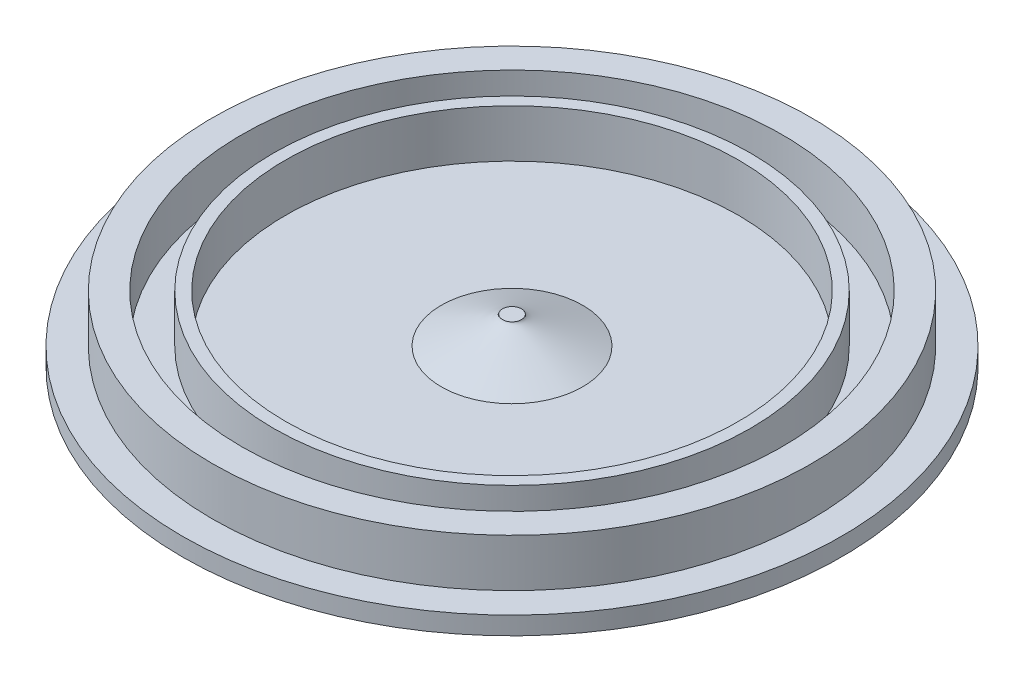
from build123d import *

# Parameters (mm, degrees)
SKETCH1_R           = 69.85
BOSS_EXTRUDE1_DEPTH = 3.81
SKETCH2_R           = 63.5
SKETCH2_R_2         = 57.2897
BOSS_EXTRUDE2_DEPTH = 10.16
SKETCH3_R           = 50.546
SKETCH3_R_2         = 48.006
BOSS_EXTRUDE3_DEPTH = 10.16


with BuildPart() as part:
    # Sketch1 → Boss-Extrude1 (new body)
    with BuildSketch(Plane(origin=(0, 0, 0), x_dir=(1, 0, 0), z_dir=(0, 1, 0))):
        with Locations(Location((0, 0, 0), (0, 0, 90))):
            Circle(SKETCH1_R)
    extrude(amount=BOSS_EXTRUDE1_DEPTH)

    # Sketch2 → Boss-Extrude2 (add)
    with BuildSketch(Plane(origin=(0, 3.81, 0), x_dir=(1, 0, 0), z_dir=(0, 1, 0))):
        with Locations(Location((0, 0, 0), (0, 0, 270))):
            Circle(SKETCH2_R)
        with Locations(Location((0, 0, 0), (0, 0, 270))):
            Circle(SKETCH2_R_2, mode=Mode.SUBTRACT)
    extrude(amount=BOSS_EXTRUDE2_DEPTH)

    # Sketch3 → Boss-Extrude3 (add)
    with BuildSketch(Plane(origin=(0, 3.81, 0), x_dir=(1, 0, 0), z_dir=(0, 1, 0))):
        with Locations(Location((0, 0, 0), (0, 0, 270))):
            Circle(SKETCH3_R)
        with Locations(Location((0, 0, 0), (0, 0, 270))):
            Circle(SKETCH3_R_2, mode=Mode.SUBTRACT)
    extrude(amount=BOSS_EXTRUDE3_DEPTH)

    # Loft1: read off the stored shape, not the designer's step
    # Loft1: loft between two sections, ruled curve by curve
    loft1_from = [
        Edge.make_bspline([(-1.815697125, 9.652, 0.82394245), (-3.463582025, 9.652, -2.8074518), (0.167812225, 9.652, -4.4553367), (1.815697125, 9.652, -0.82394245), (3.463582025, 9.652, 2.8074518), (-0.167812225, 9.652, 4.4553367), (-1.815697125, 9.652, 0.82394245)], [0, 0, 0, 0, 0.5, 0.5, 0.5, 1, 1, 1, 1], 3, [1, 0.333333333, 0.333333333, 1, 0.333333333, 0.333333333, 1]),
    ]
    loft1_to = [
        Edge.make_bspline([(4.253244453, 3.81, 14.369763659), (-24.486282866, 3.81, 22.876252565), (-32.992771771, 3.81, -5.863274754), (-4.253244453, 3.81, -14.369763659), (24.486282866, 3.81, -22.876252565), (32.992771771, 3.81, 5.863274754), (4.253244453, 3.81, 14.369763659)], [0, 0, 0, 0, 0.5, 0.5, 0.5, 1, 1, 1, 1], 3, [1, 0.333333333, 0.333333333, 1, 0.333333333, 0.333333333, 1]),
    ]
    loft1 = Solid(Shell([*[Face.make_surface_from_curves(loft1_from[k], loft1_to[k]) for k in range(1)], Face(Wire(loft1_from)), Face(Wire(loft1_to))]))
    add(loft1)


solid = part.part
